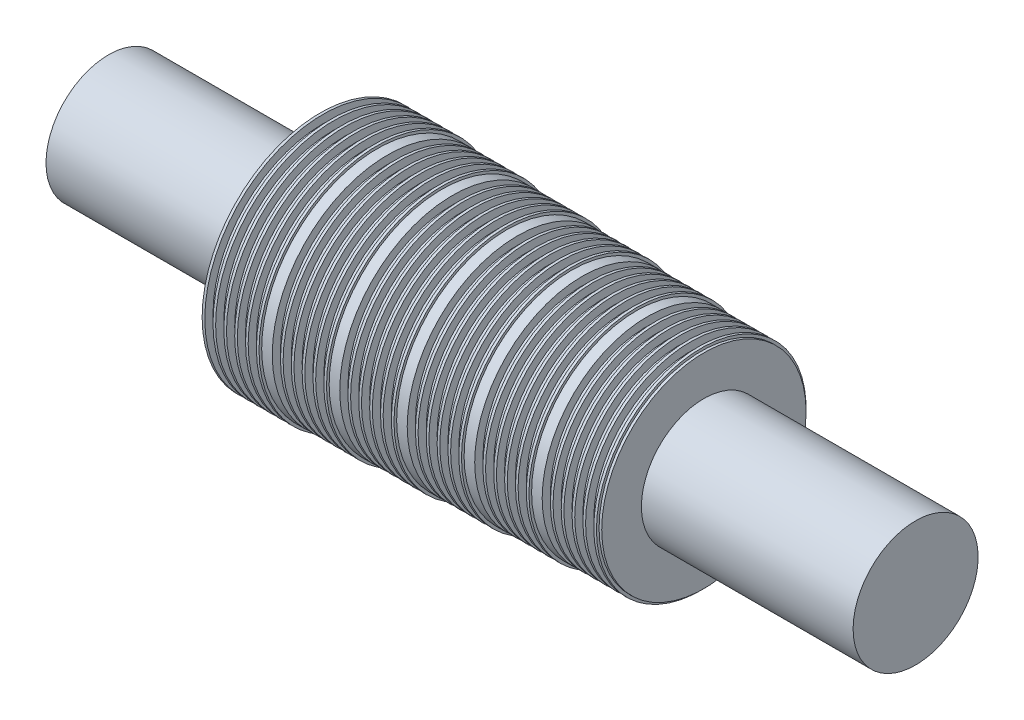
from build123d import *


with BuildPart() as part:
    # Sketch1 → Revolve1 (revolve)
    with BuildSketch(Plane.XY):
        Polygon((20.574, 11.333988), (20.574, 10.546588), (21.3614, 10.546588), (21.3614, 11.333988), (21.6154, 11.333988), (21.6154, 10.546588), (22.4028, 10.546588), (22.4028, 11.333988), (22.6568, 11.333988), (22.6568, 10.546588), (23.4442, 10.546588), (23.4442, 11.333988), (23.6982, 11.333988), (23.6982, 10.546588), (24.4856, 10.546588), (24.4856, 11.333988), (24.7396, 11.333988), (24.7396, 10.546588), (25.527, 10.546588), (25.527, 11.333988), (25.781, 11.333988), (25.781, 11.079988), (26.797, 11.079988), (26.797, 10.292588), (27.5844, 10.292588), (27.5844, 11.079988), (27.8384, 11.079988), (27.8384, 10.292588), (28.6258, 10.292588), (28.6258, 11.079988), (28.8798, 11.079988), (28.8798, 10.292588), (29.6672, 10.292588), (29.6672, 11.079988), (29.9212, 11.079988), (29.9212, 10.292588), (30.7086, 10.292588), (30.7086, 11.079988), (30.9626, 11.079988), (30.9626, 10.292588), (31.75, 10.292588), (31.75, 11.079988), (32.004, 11.079988), (32.004, 10.825988), (33.02, 10.825988), (33.02, 10.038588), (33.8074, 10.038588), (33.8074, 10.825988), (34.0614, 10.825988), (34.0614, 10.038588), (34.8488, 10.038588), (34.8488, 10.825988), (35.1028, 10.825988), (35.1028, 10.038588), (35.8902, 10.038588), (35.8902, 10.825988), (36.1442, 10.825988), (36.1442, 10.038588), (36.9316, 10.038588), (36.9316, 10.825988), (37.1856, 10.825988), (37.1856, 10.038588), (37.973, 10.038588), (37.973, 10.825988), (38.227, 10.825988), (38.227, 10.571988), (39.243, 10.571988), (39.243, 9.784588), (40.0304, 9.784588), (40.0304, 10.571988), (40.2844, 10.571988), (40.2844, 9.784588), (41.0718, 9.784588), (41.0718, 10.571988), (41.3258, 10.571988), (41.3258, 9.784588), (42.1132, 9.784588), (42.1132, 10.571988), (42.3672, 10.571988), (42.3672, 9.784588), (43.1546, 9.784588), (43.1546, 10.571988), (43.4086, 10.571988), (43.4086, 9.784588), (44.196, 9.784588), (44.196, 10.571988), (44.45, 10.571988), (44.45, 10.317988), (45.466, 10.317988), (45.466, 9.530588), (46.2534, 9.530588), (46.2534, 10.317988), (46.5074, 10.317988), (46.5074, 9.530588), (47.2948, 9.530588), (47.2948, 10.317988), (47.5488, 10.317988), (47.5488, 9.530588), (48.3362, 9.530588), (48.3362, 10.317988), (48.5902, 10.317988), (48.5902, 9.530588), (49.3776, 9.530588), (49.3776, 10.317988), (49.6316, 10.317988), (49.6316, 9.530588), (50.419, 9.530588), (50.419, 10.317988), (50.673, 10.317988), (50.673, 10.063988), (51.689, 10.063988), (51.689, 9.276588), (52.4764, 9.276588), (52.4764, 10.063988), (52.7304, 10.063988), (52.7304, 9.276588), (53.5178, 9.276588), (53.5178, 10.063988), (53.7718, 10.063988), (53.7718, 9.276588), (54.5592, 9.276588), (54.5592, 10.063988), (54.8132, 10.063988), (54.8132, 9.276588), (55.6006, 9.276588), (55.6006, 10.063988), (55.8546, 10.063988), (55.8546, 9.276588), (56.642, 9.276588), (56.642, 10.063988), (56.896, 10.063988), (56.896, 9.809988), (57.15, 9.809988), (57.15, 5.999988), (77.47, 5.999988), (77.47, 0), (61.976, 0), (0, 0), (0, 5.999988), (20.32, 5.999988), (20.32, 11.333988), align=None)
    revolve(axis=Axis((0, 0, 0), (1, 0, 0)))


solid = part.part
